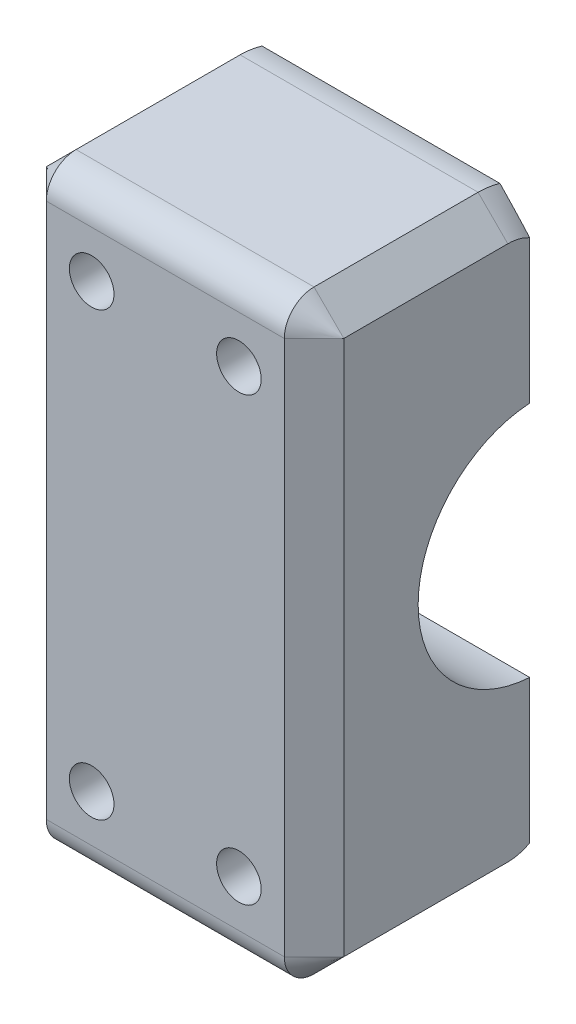
from build123d import *

# Parameters (mm, degrees)
SKETCH2_W           = 20
SKETCH2_H           = 49.6
SKETCH2_R           = 1.5
BOSS_EXTRUDE1_DEPTH = 30
CUT_EXTRUDE1_DEPTH  = 30
CUT_EXTRUDE2_DEPTH  = 22
FILLET1_R           = 5
FILLET2_R           = 2
CHAMFER1_SIZE       = 2
SKETCH5_R           = 3
SKETCH5_R_2         = 1.5
CUT_EXTRUDE3_DEPTH  = 12
CUT_EXTRUDE4_DEPTH  = 23


with BuildPart() as part:
    # Sketch2 → Boss-Extrude1 (new body)
    with BuildSketch(Plane.XY):
        with Locations((20.689228864, 114.541105708)):
            Rectangle(SKETCH2_W, SKETCH2_H)
        with Locations((15.739481395, 99.69135824)):
            Circle(SKETCH2_R, mode=Mode.SUBTRACT)
        with Locations((25.638976332, 99.69135824)):
            Circle(SKETCH2_R, mode=Mode.SUBTRACT)
        with Locations((25.638976332, 129.390853177)):
            Circle(SKETCH2_R, mode=Mode.SUBTRACT)
        with Locations((15.739481395, 129.390853177)):
            Circle(SKETCH2_R, mode=Mode.SUBTRACT)
    extrude(amount=BOSS_EXTRUDE1_DEPTH)

    # Sketch3 → Cut-Extrude1 (cut)
    with BuildSketch(Plane(origin=(30.689228864, 0, 0), x_dir=(0, 0, -1), z_dir=(1, 0, 0))):
        Polygon((-10, 119.541105708), (-18.024193548, 119.541105708), (-11.975806452, 109.541105708), (-10, 109.541105708), align=None)
        Polygon((-11.975806452, 109.541105708), (-18.024193548, 119.541105708), (-20, 119.541105708), (-20, 109.541105708), align=None)
    extrude(amount=-CUT_EXTRUDE1_DEPTH, mode=Mode.SUBTRACT)

    # Sketch4 → Cut-Extrude2 (cut)
    with BuildSketch(Plane(origin=(30.689228864, 0, 0), x_dir=(0, 0, -1), z_dir=(1, 0, 0))):
        Polygon((-30, 139.341105708), (-27.096774194, 134.541105708), (-15, 134.541105708), (0, 134.541105708), (0, 139.341105708), align=None)
        Polygon((-30, 134.541105708), (-27.096774194, 134.541105708), (-30, 139.341105708), align=None)
        Polygon((-15, 134.541105708), (0, 120.541105708), (0, 134.541105708), align=None)
        Polygon((-7.268041237, 101.757600554), (-2.903225806, 94.541105708), (0, 94.541105708), (0, 108.541105708), align=None)
        Polygon((-15, 94.541105708), (-2.903225806, 94.541105708), (-7.268041237, 101.757600554), align=None)
        Polygon((-30, 89.741105708), (0, 89.741105708), (-2.903225806, 94.541105708), (-15, 94.541105708), (-30, 94.541105708), align=None)
        Polygon((-2.903225806, 94.541105708), (0, 89.741105708), (0, 94.541105708), align=None)
    extrude(amount=-CUT_EXTRUDE2_DEPTH, mode=Mode.SUBTRACT)

    # Fillet1
    fillet1_edges = [part.edges().sort_by_distance(p)[0] for p in [
        (20.689228864, 134.541105708, 15),
        (20.689228864, 120.541105708, 0),
        (20.689228864, 94.541105708, 15),
        (20.689228864, 108.541105708, 0),
    ]]
    fillet(fillet1_edges, radius=FILLET1_R)

    # Fillet2
    fillet2_edges = [part.edges().sort_by_distance(p)[0] for p in [
        (20.689228864, 134.541105708, 30),
        (20.689228864, 94.541105708, 30),
    ]]
    fillet(fillet2_edges, radius=FILLET2_R)

    # Chamfer1
    chamfer1_edges = [part.edges().sort_by_distance(p)[0] for p in [
        (30.689228864, 127.610001295, 7.5738167),
        (10.689228864, 127.610001295, 7.5738167),
        (30.689228864, 114.541105708, 0),
        (30.689228864, 101.472210122, 7.5738167),
        (30.689228864, 108.721124919, 0.414263622),
        (30.689228864, 120.361086498, 0.414263622),
        (30.689228864, 94.889418826, 15.137292206),
        (30.689228864, 134.192792591, 15.137292206),
        (10.689228864, 114.541105708, 0),
        (10.689228864, 101.472210122, 7.5738167),
        (10.689228864, 108.721124919, 0.414263622),
        (10.689228864, 120.361086498, 0.414263622),
        (10.689228864, 94.889418826, 15.137292206),
        (10.689228864, 134.192792591, 15.137292206),
        (10.689228864, 114.541105708, 30),
        (30.689228864, 114.541105708, 30),
        (30.689228864, 134.541105708, 22.485407952),
        (30.689228864, 94.541105708, 22.485407952),
        (30.689228864, 133.955319271, 29.414213562),
        (30.689228864, 95.126892146, 29.414213562),
        (10.689228864, 94.541105708, 22.485407952),
        (10.689228864, 134.541105708, 22.485407952),
        (10.689228864, 133.955319271, 29.414213562),
        (10.689228864, 95.126892146, 29.414213562),
    ]]
    chamfer(chamfer1_edges, length=CHAMFER1_SIZE - 0.0001)  # a hair under: the kernel refuses the full size

    # Sketch5 → Cut-Extrude3 (cut)
    # profile 1 of 4: a face of its own
    with BuildSketch(Plane(origin=(0, 0, 0), x_dir=(-1, 0, 0), z_dir=(0, 0, -1))):
        with Locations((-15.739481395, 99.69135824)):
            Circle(SKETCH5_R)
        with Locations((-15.739481395, 99.69135824)):
            Circle(SKETCH5_R_2, mode=Mode.SUBTRACT)
    # profile 2 of 4: a face of its own
    with BuildSketch(Plane(origin=(0, 0, 0), x_dir=(-1, 0, 0), z_dir=(0, 0, -1))):
        with Locations((-25.638976332, 99.69135824)):
            Circle(SKETCH5_R)
        with Locations((-25.638976332, 99.69135824)):
            Circle(SKETCH5_R_2, mode=Mode.SUBTRACT)
    # profile 3 of 4: a face of its own
    with BuildSketch(Plane(origin=(0, 0, 0), x_dir=(-1, 0, 0), z_dir=(0, 0, -1))):
        with Locations((-15.739481395, 129.390853177)):
            Circle(SKETCH5_R)
        with Locations((-15.739481395, 129.390853177)):
            Circle(SKETCH5_R_2, mode=Mode.SUBTRACT)
    # profile 4 of 4: a face of its own
    with BuildSketch(Plane(origin=(0, 0, 0), x_dir=(-1, 0, 0), z_dir=(0, 0, -1))):
        with Locations((-25.638976332, 129.390853177)):
            Circle(SKETCH5_R)
        with Locations((-25.638976332, 129.390853177)):
            Circle(SKETCH5_R_2, mode=Mode.SUBTRACT)
    extrude(amount=-CUT_EXTRUDE3_DEPTH, mode=Mode.SUBTRACT)

    # Sketch6 → Cut-Extrude4 (cut)
    with BuildSketch(Plane.ZY.offset(-10.689228864)):
        with BuildLine():
            Line((15, 91.202832585), (15, 97.279273558))
            ThreePointArc((15, 97.279273558), (14.961637209, 97.313281439), (14.923861152, 97.347939904))
            Line((14.923861152, 97.347939904), (2.953045249, 108.520701413))
            ThreePointArc((2.953045249, 108.520701413), (2.248558173, 109.518221838), (2, 110.713867218))
            Line((2, 110.713867218), (2, 118.368344199))
            ThreePointArc((2, 118.368344199), (2.248558173, 119.563989578), (2.953045249, 120.561510003))
            Line((2.953045249, 120.561510003), (14.923861152, 131.734271513))
            ThreePointArc((14.923861152, 131.734271513), (14.961637209, 131.768929978), (15, 131.802937859))
            Line((15, 131.802937859), (15, 137.879378832))
            Line((15, 137.879378832), (-6.953674883, 137.879378832))
            Line((-6.953674883, 137.879378832), (-6.953674883, 91.202832585))
            Line((-6.953674883, 91.202832585), (15, 91.202832585))
        make_face()
        with BuildLine():
            Line((15, 122.541105708), (15, 119.541105708))
            Line((15, 119.541105708), (15.5, 119.541105708))
            Line((15.5, 119.541105708), (15.5, 122.52546542))
            ThreePointArc((15.5, 122.52546542), (15.250122279, 122.53719468), (15, 122.541105708))
        make_face()
        with BuildLine():
            Line((20, 109.541105708), (15.5, 109.541105708))
            Line((15.5, 109.541105708), (15.5, 106.556745997))
            ThreePointArc((15.5, 106.556745997), (20.830951895, 109.063880133), (23, 114.541105708))
            ThreePointArc((23, 114.541105708), (20.830951895, 120.018331283), (15.5, 122.52546542))
            Line((15.5, 122.52546542), (15.5, 119.541105708))
            Line((15.5, 119.541105708), (20, 119.541105708))
            Line((20, 119.541105708), (20, 109.541105708))
        make_face()
        with BuildLine():
            Line((15, 109.541105708), (10, 109.541105708))
            Line((10, 109.541105708), (10, 119.541105708))
            Line((10, 119.541105708), (15, 119.541105708))
            Line((15, 119.541105708), (15, 122.541105708))
            ThreePointArc((15, 122.541105708), (7, 114.541105708), (15, 106.541105708))
            Line((15, 106.541105708), (15, 109.541105708))
        make_face()
        Polygon((10, 119.541105708), (10, 109.541105708), (15, 114.541105708), (15, 119.541105708), align=None)
        Polygon((15, 119.541105708), (15, 114.541105708), (15.5, 115.041105708), (15.5, 119.541105708), align=None)
        Polygon((15.5, 119.541105708), (15.5, 115.041105708), (20, 119.541105708), align=None)
        Polygon((20, 119.541105708), (15.5, 115.041105708), (15.5, 109.541105708), (20, 109.541105708), align=None)
        Polygon((15.5, 115.041105708), (15, 114.541105708), (15, 109.541105708), (15.5, 109.541105708), align=None)
        Polygon((15, 114.541105708), (10, 109.541105708), (15, 109.541105708), align=None)
        with BuildLine():
            Line((15.5, 109.541105708), (15, 109.541105708))
            Line((15, 109.541105708), (15, 106.541105708))
            ThreePointArc((15, 106.541105708), (15.250122279, 106.545016736), (15.5, 106.556745997))
            Line((15.5, 106.556745997), (15.5, 109.541105708))
        make_face()
        with BuildLine():
            Line((15, 131.802937859), (15, 122.541105708))
            ThreePointArc((15, 122.541105708), (15.250122279, 122.53719468), (15.5, 122.52546542))
            Line((15.5, 122.52546542), (15.5, 132.155814216))
            ThreePointArc((15.5, 132.155814216), (15.240978395, 131.992158991), (15, 131.802937859))
        make_face()
        with BuildLine():
            ThreePointArc((15.5, 96.926397201), (15.240978395, 97.090052425), (15, 97.279273558))
            Line((15, 97.279273558), (15, 91.202832585))
            Line((15, 91.202832585), (15.5, 91.202832585))
            Line((15.5, 91.202832585), (15.5, 96.926397201))
        make_face()
        with BuildLine():
            ThreePointArc((15.5, 106.556745997), (15.250122279, 106.545016736), (15, 106.541105708))
            Line((15, 106.541105708), (15, 97.279273558))
            ThreePointArc((15, 97.279273558), (15.240978395, 97.090052425), (15.5, 96.926397201))
            Line((15.5, 96.926397201), (15.5, 106.556745997))
        make_face()
        with BuildLine():
            Line((15, 97.279273558), (15, 106.541105708))
            ThreePointArc((15, 106.541105708), (7, 114.541105708), (15, 122.541105708))
            Line((15, 122.541105708), (15, 131.802937859))
            ThreePointArc((15, 131.802937859), (14.961637209, 131.768929978), (14.923861152, 131.734271513))
            Line((14.923861152, 131.734271513), (2.953045249, 120.561510003))
            ThreePointArc((2.953045249, 120.561510003), (2.248558173, 119.563989578), (2, 118.368344199))
            Line((2, 118.368344199), (2, 110.713867218))
            ThreePointArc((2, 110.713867218), (2.248558173, 109.518221838), (2.953045249, 108.520701413))
            Line((2.953045249, 108.520701413), (14.923861152, 97.347939904))
            ThreePointArc((14.923861152, 97.347939904), (14.961637209, 97.313281439), (15, 97.279273558))
        make_face()
        with BuildLine():
            Line((15, 137.879378832), (15, 131.802937859))
            ThreePointArc((15, 131.802937859), (15.240978395, 131.992158991), (15.5, 132.155814216))
            Line((15.5, 132.155814216), (15.5, 137.879378832))
            Line((15.5, 137.879378832), (15, 137.879378832))
        make_face()
    extrude(amount=-CUT_EXTRUDE4_DEPTH, mode=Mode.SUBTRACT)


solid = part.part
